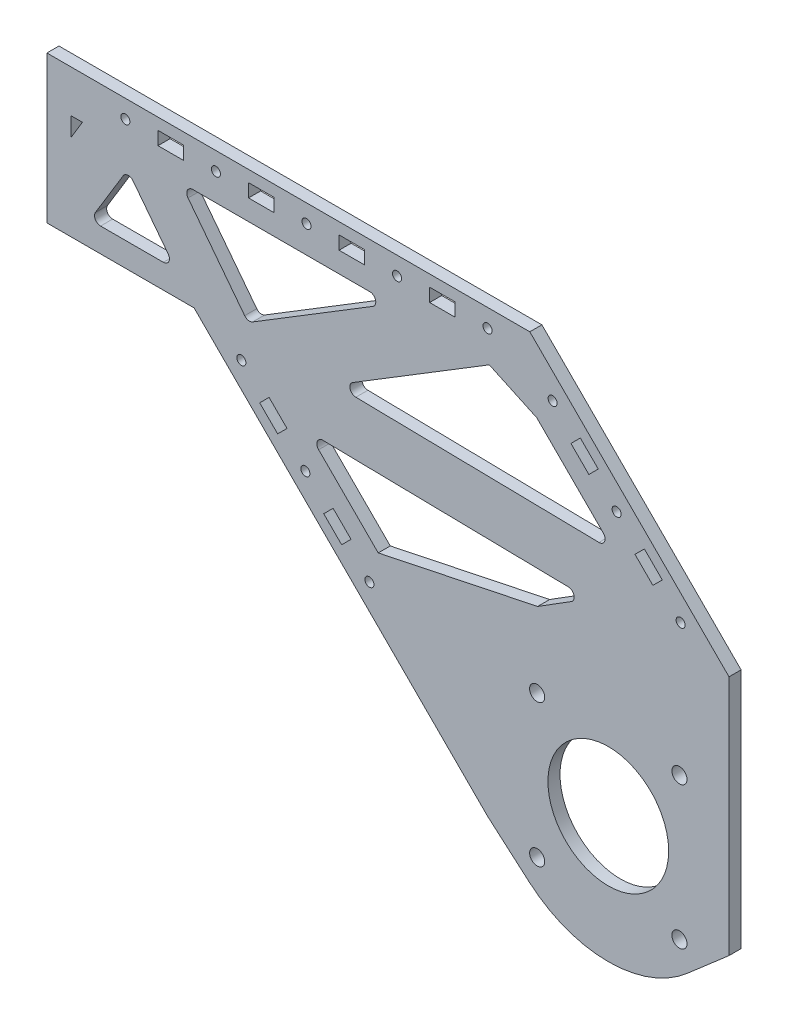
from build123d import *

# Parameters (mm, degrees)
SKETCH_1_R          = 1.5
SKETCH_1_R_2        = 20
SKETCH_1_R_3        = 2.5
SKETCH_1_W          = 8.4
SKETCH_1_H          = 4.4
EXTRUDE_1_DEPTH     = 4
CUT_EXTRUDE_1_DEPTH = 10


with BuildPart() as part:
    # 草图1 → 凸台-拉伸1 (new body)
    with BuildSketch(Plane.XY):
        with BuildLine():
            Line((7.027428163, -4.945261799), (20.814741953, -16.906627127))
            ThreePointArc((20.814741953, -16.906627127), (47.027428163, -26.692473463), (73.240114374, -16.906627127))
            Line((73.240114374, -16.906627127), (87.027428163, -4.945261799))
            Line((87.027428163, -4.945261799), (87.027428163, 75.054738201))
            Line((87.027428163, 75.054738201), (21.027428163, 141.054738201))
            Line((21.027428163, 141.054738201), (-138.972571837, 141.054738201))
            Line((-138.972571837, 141.054738201), (-138.972571837, 92.286109212))
            Line((-138.972571837, 92.286109212), (-90.203942848, 92.286109212))
            Line((-90.203942848, 92.286109212), (7.027428163, -4.945261799))
        make_face()
        with Locations((-52.972571837, 135.054738201)):
            Circle(SKETCH_1_R, mode=Mode.SUBTRACT)
        with Locations((47.027428163, 15.054738201)):
            Circle(SKETCH_1_R_2, mode=Mode.SUBTRACT)
        with Locations((-22.972571837, 135.054738201)):
            Circle(SKETCH_1_R, mode=Mode.SUBTRACT)
        with Locations((7.027428163, 135.054738201)):
            Circle(SKETCH_1_R, mode=Mode.SUBTRACT)
        with Locations((-112.972571837, 135.054738201)):
            Circle(SKETCH_1_R, mode=Mode.SUBTRACT)
        with Locations((-82.972571837, 135.054738201)):
            Circle(SKETCH_1_R, mode=Mode.SUBTRACT)
        with Locations((49.784787476, 103.812097514)):
            Circle(SKETCH_1_R, mode=Mode.SUBTRACT)
        with Locations((70.997990912, 82.598894078)):
            Circle(SKETCH_1_R, mode=Mode.SUBTRACT)
        with Locations((28.571584041, 125.025300949)):
            Circle(SKETCH_1_R, mode=Mode.SUBTRACT)
        with Locations((-53.337194475, 63.904642213)):
            Circle(SKETCH_1_R, mode=Mode.SUBTRACT)
        with Locations((-32.123991039, 42.691438778)):
            Circle(SKETCH_1_R, mode=Mode.SUBTRACT)
        with Locations((-74.55039791, 85.117845649)):
            Circle(SKETCH_1_R, mode=Mode.SUBTRACT)
        with Locations((70.597428163, 38.624738201)):
            Circle(SKETCH_1_R_3, mode=Mode.SUBTRACT)
        with Locations((70.597428163, -8.515261799)):
            Circle(SKETCH_1_R_3, mode=Mode.SUBTRACT)
        with Locations((23.457428163, -8.515261799)):
            Circle(SKETCH_1_R_3, mode=Mode.SUBTRACT)
        with Locations((23.457428163, 38.624738201)):
            Circle(SKETCH_1_R_3, mode=Mode.SUBTRACT)
        with Locations((-37.972571837, 135.054738201)):
            Rectangle(SKETCH_1_W, SKETCH_1_H, mode=Mode.SUBTRACT)
        with Locations((-7.972571837, 135.054738201)):
            Rectangle(SKETCH_1_W, SKETCH_1_H, mode=Mode.SUBTRACT)
        with Locations((-97.972571837, 135.054738201)):
            Rectangle(SKETCH_1_W, SKETCH_1_H, mode=Mode.SUBTRACT)
        with Locations((-67.972571837, 135.054738201)):
            Rectangle(SKETCH_1_W, SKETCH_1_H, mode=Mode.SUBTRACT)
        Polygon((55.865905794, 94.619709358), (61.805602756, 88.680012396), (64.916872594, 91.791282234), (58.977175632, 97.730979196), align=None, mode=Mode.SUBTRACT)
        Polygon((34.652702359, 115.832912794), (37.763972196, 118.944182631), (43.703669158, 113.004485669), (40.592399321, 109.893215832), align=None, mode=Mode.SUBTRACT)
        Polygon((-47.256076157, 54.712254058), (-41.316379195, 48.772557096), (-38.205109357, 51.883826933), (-44.144806319, 57.823523895), align=None, mode=Mode.SUBTRACT)
        Polygon((-68.469279592, 75.925457494), (-65.358009755, 79.036727331), (-59.418312793, 73.097030369), (-62.52958263, 69.985760532), align=None, mode=Mode.SUBTRACT)
    extrude(amount=EXTRUDE_1_DEPTH)

    # 草图2 → 切除-拉伸1 (cut)
    with BuildSketch(Plane(origin=(0, 0, 0), x_dir=(-1, 0, 0), z_dir=(0, 0, -1))):
        with BuildLine():
            Line((98.792246858, 103.505713788), (110.418981679, 118.616857906))
            ThreePointArc((110.418981679, 118.616857906), (112.113620797, 119.394251765), (113.713072721, 118.436182616))
            Line((113.713072721, 118.436182616), (122.899473042, 103.325038498))
            ThreePointArc((122.899473042, 103.325038498), (122.933741653, 101.305767071), (121.190489151, 100.286109212))
            Line((121.190489151, 100.286109212), (100.377354008, 100.286109212))
            ThreePointArc((100.377354008, 100.286109212), (98.583028348, 101.402709289), (98.792246858, 103.505713788))
        make_face()
        Polygon((127.198237985, 127.054738201), (130.972571837, 120.84615804), (130.972571837, 127.054738201), align=None)
        with BuildLine():
            Line((73.446278945, 98.44171591), (92.214930542, 122.835133626))
            ThreePointArc((92.214930542, 122.835133626), (92.424149051, 124.938138124), (90.629823391, 126.054738201))
            Line((90.629823391, 126.054738201), (32.011635988, 126.054738201))
            ThreePointArc((32.011635988, 126.054738201), (30.086594754, 124.59715524), (30.967460822, 122.348954445))
            Line((30.967460822, 122.348954445), (70.816996628, 97.955536729))
            ThreePointArc((70.816996628, 97.955536729), (72.224826028, 97.694659457), (73.446278945, 98.44171591))
        make_face()
        with BuildLine():
            Line((36.616706696, 93.462689168), (-43.937662379, 92.068564807))
            ThreePointArc((-43.937662379, 92.068564807), (-45.813338133, 93.286939697), (-45.386484011, 95.482478917))
            Line((-45.386484011, 95.482478917), (-23.33185922, 117.537103709))
            Line((-23.33185922, 117.537103709), (-7.607283327, 124.857355573))
            Line((-7.607283327, 124.857355573), (37.626273792, 97.168173472))
            ThreePointArc((37.626273792, 97.168173472), (38.51176098, 94.936649095), (36.616706696, 93.462689168))
        make_face()
        with BuildLine():
            Line((29.20140553, 52.49677533), (-23.612246698, 63.53541151))
            Line((-23.612246698, 63.53541151), (-34.805439363, 70.547080779))
            ThreePointArc((-34.805439363, 70.547080779), (-35.670630649, 72.777688158), (-33.778316178, 74.241693343))
            Line((-33.778316178, 74.241693343), (47.490069377, 75.64817492))
            ThreePointArc((47.490069377, 75.64817492), (49.365745131, 74.42980003), (48.93889101, 72.23426081))
            Line((48.93889101, 72.23426081), (29.20140553, 52.49677533))
        make_face()
    extrude(amount=-CUT_EXTRUDE_1_DEPTH, mode=Mode.SUBTRACT)


solid = part.part
